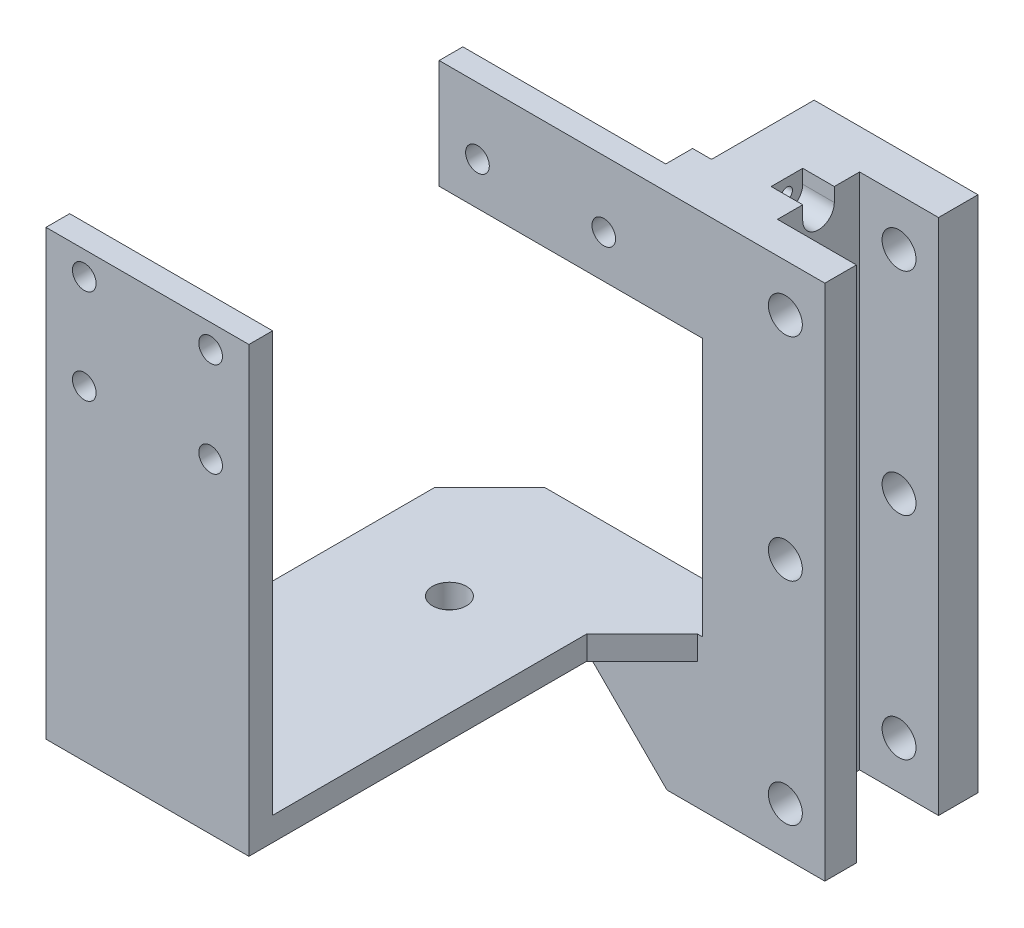
from build123d import *

# Parameters (mm, degrees)
SKETCH1_W                       = 14
SKETCH1_H                       = 4
BOSS_EXTRUDE1_DEPTH             = 10.2
SKETCH1_7_W                     = 14
SKETCH1_7_H                     = 4
BOSS_EXTRUDE2_DEPTH             = 3
BOSS_EXTRUDE3_START             = 10.2
SKETCH1_8_W                     = 14
SKETCH1_8_H                     = 4
BOSS_EXTRUDE3_DEPTH             = 3
BOSS_EXTRUDE6_START             = 13.2
SKETCH1_11_W                    = 14
SKETCH1_11_H                    = 4
BOSS_EXTRUDE6_DEPTH             = 3
BOSS_EXTRUDE4_START             = 14.1
SKETCH1_9_W                     = 14
SKETCH1_9_H                     = 4
SKETCH1_9_R                     = 2.15
SKETCH1_9_W_2                   = 19.7
SKETCH1_9_H_2                   = 40.2
BOSS_EXTRUDE4_DEPTH             = 3
BOSS_EXTRUDE7_START             = -18.65
SKETCH2_R                       = 2.15
BOSS_EXTRUDE7_DEPTH             = 3
SKETCH2_3_W                     = 14
SKETCH2_3_H                     = 4
BOSS_EXTRUDE9_DEPTH             = 21.65
BOSS_EXTRUDE8_REACH             = 52.867
SKETCH1_12_W                    = 25.7
SKETCH1_12_H                    = 3
BOSS_EXTRUDE8_DIRECTION_2_REACH = 52.867
BOSS_EXTRUDE10_OUTLINE_W        = 19.4
BOSS_EXTRUDE10_OUTLINE_H        = 65.6
BOSS_EXTRUDE10_DEPTH            = 26
CUT_EXTRUDE2_DEPTH              = 64.646916657
CUT_EXTRUDE2_DEPTH_BACK         = 64.646916657
SKETCH4_3_W                     = 5.6
SKETCH4_3_H                     = 13.8
CUT_EXTRUDE3_START              = -18.65
SKETCH6_R                       = 23.55
CUT_EXTRUDE3_DEPTH              = 32.75
BOSS_EXTRUDE11_START            = 26
SKETCH4_4_W                     = 5
SKETCH4_4_H                     = 12
SKETCH4_4_W_2                   = 4
SKETCH4_4_H_2                   = 14
SKETCH4_4_H_3                   = 6.75
SKETCH4_4_H_4                   = 7.05
SKETCH4_4_H_5                   = 13.8
SKETCH4_4_H_6                   = 1.8
BOSS_EXTRUDE11_DEPTH            = 10
CUT_EXTRUDE4_DEPTH              = 69.344202388
CUT_EXTRUDE4_DEPTH_BACK         = 69.344202388
SKETCH7_W                       = 15.846906961
SKETCH7_H                       = 18.461570713
SKETCH7_W_2                     = 11.728499311
SKETCH7_H_2                     = 5.461570713
CUT_EXTRUDE5_START              = 17.1
SKETCH1_14_R                    = 2.15
SKETCH1_14_W                    = 19.7
SKETCH1_14_H                    = 40.2
CUT_EXTRUDE5_DEPTH              = 10.8
CUT_EXTRUDE1_START              = 17.1
SKETCH3_W                       = 2
SKETCH3_H                       = 7
CUT_EXTRUDE1_DEPTH              = 1
CUT_EXTRUDE6_START              = 14.1
CUT_EXTRUDE6_OUTLINE_R          = 2.15
CUT_EXTRUDE6_DEPTH              = 3
CUT_EXTRUDE7_DEPTH              = 67.412442358
CUT_EXTRUDE7_DEPTH_BACK         = 67.412442358
SKETCH8_R                       = 2.15
CHAMFER1_SIZE                   = 7
CHAMFER2_SIZE                   = 7
CUT_EXTRUDE8_DEPTH              = 67.412442358
CUT_EXTRUDE8_DEPTH_BACK         = 67.412442358
SKETCH9_W                       = 15.2446712
SKETCH9_H                       = 13
CHAMFER4_SIZE                   = 16
SKETCH10_R                      = 0.7
CUT_EXTRUDE10_DEPTH             = 67.412442358
CUT_EXTRUDE11_START             = 22
SKETCH10_3_R                    = 0.7
CUT_EXTRUDE11_DEPTH             = 4
CUT_EXTRUDE12_START             = 17.1
CUT_EXTRUDE12_DEPTH             = 35.75
SKETCH14_W                      = 28.5
SKETCH14_H                      = 6.888877351
CUT_EXTRUDE13_DEPTH             = 67.412442358
BOSS_EXTRUDE13_START            = -18.65
SKETCH14_3_W                    = 25.7
SKETCH14_3_H                    = 3
BOSS_EXTRUDE13_DEPTH            = 53.15
BOSS_EXTRUDE14_START            = 12.85
SKETCH16_W                      = 3
SKETCH16_H                      = 13.8
BOSS_EXTRUDE14_DEPTH            = 25.7
CUT_EXTRUDE14_DEPTH             = 67.412442358
CUT_EXTRUDE14_DEPTH_BACK        = 67.412442358
SKETCH15_R                      = 1.5


# Read off the part's stored shape, not the designer's step: Boss-Extrude10, Cut-Extrude6
with BuildPart() as part:
    # Sketch1 → Boss-Extrude1 (new body)
    with BuildSketch(Plane(origin=(0, 0, 0), x_dir=(1, 0, 0), z_dir=(0, 1, 0))):
        with Locations((0, 42.2)):
            Rectangle(SKETCH1_W, SKETCH1_H)
    extrude(amount=BOSS_EXTRUDE1_DEPTH)

    # Sketch1<7> → Boss-Extrude2 (add)
    with BuildSketch(Plane(origin=(0, 0, 0), x_dir=(1, 0, 0), z_dir=(0, 1, 0))):
        with Locations((0, 42.2)):
            Rectangle(SKETCH1_7_W, SKETCH1_7_H)
    extrude(amount=-BOSS_EXTRUDE2_DEPTH)

    # Sketch1<8> → Boss-Extrude3 (add)
    with BuildSketch(Plane(origin=(0, 0, 0), x_dir=(1, 0, 0), z_dir=(0, 1, 0)).offset(BOSS_EXTRUDE3_START)):
        with Locations((0, 42.2)):
            Rectangle(SKETCH1_8_W, SKETCH1_8_H)
    extrude(amount=BOSS_EXTRUDE3_DEPTH)

    # Sketch1<11> → Boss-Extrude6 (add)
    with BuildSketch(Plane(origin=(0, 0, 0), x_dir=(1, 0, 0), z_dir=(0, 1, 0)).offset(BOSS_EXTRUDE6_START)):
        with Locations((0, 42.2)):
            Rectangle(SKETCH1_11_W, SKETCH1_11_H)
    extrude(amount=BOSS_EXTRUDE6_DEPTH)

    # Sketch1<9> → Boss-Extrude4 (add)
    # profile 1 of 3: a face of its own
    with BuildSketch(Plane(origin=(0, 0, 0), x_dir=(1, 0, 0), z_dir=(0, 1, 0)).offset(BOSS_EXTRUDE4_START)):
        with Locations((0, 42.2)):
            Rectangle(SKETCH1_9_W, SKETCH1_9_H)
    # profile 2 of 3: a face of its own
    with BuildSketch(Plane(origin=(0, 0, 0), x_dir=(1, 0, 0), z_dir=(0, 1, 0)).offset(BOSS_EXTRUDE4_START)):
        Polygon((12.85, -29.1), (12.85, 28.2), (7, 40.2), (-7, 40.2), (-12.85, 28.2), (-12.85, -29.1), align=None)
        with Locations(Location((5, -24.1, 0), (0, 0, 270))):
            Circle(SKETCH1_9_R, mode=Mode.SUBTRACT)
        with Locations(Location((-5, -24.1, 0), (0, 0, 270))):
            Circle(SKETCH1_9_R, mode=Mode.SUBTRACT)
        with Locations(Location((5, 24.1, 0), (0, 0, 270))):
            Circle(SKETCH1_9_R, mode=Mode.SUBTRACT)
        with Locations(Location((-5, 24.1, 0), (0, 0, 270))):
            Circle(SKETCH1_9_R, mode=Mode.SUBTRACT)
        Rectangle(SKETCH1_9_W_2, SKETCH1_9_H_2, mode=Mode.SUBTRACT)
    # profile 3 of 3: a face of its own
    with BuildSketch(Plane(origin=(0, 0, 0), x_dir=(1, 0, 0), z_dir=(0, 1, 0)).offset(BOSS_EXTRUDE4_START)):
        Polygon((7, 40.2), (-7, 40.2), (-12.41125, 29.1), (12.41125, 29.1), align=None)
    extrude(amount=BOSS_EXTRUDE4_DEPTH)



with BuildPart() as body_2:
    # Sketch2 → Boss-Extrude7 (new body)
    with BuildSketch(Plane(origin=(0, 0, 0), x_dir=(1, 0, 0), z_dir=(0, 1, 0)).offset(BOSS_EXTRUDE7_START)):
        Polygon((7, 44.2), (-7, 44.2), (-7, 40.2), (-12.85, 28.2), (-12.85, -29.1), (12.85, -29.1), (12.85, 28.2), (7, 40.2), align=None)
        with Locations(Location((0, 10.2, 0), (0, 0, 270))):
            Circle(SKETCH2_R, mode=Mode.SUBTRACT)
    extrude(amount=-BOSS_EXTRUDE7_DEPTH)


with BuildPart() as part_1:
    add(part.part)

    add(body_2.part)  # Boss-Extrude9 merges body 2
    # Sketch2<3> → Boss-Extrude9 (add)
    with BuildSketch(Plane(origin=(0, 0, 0), x_dir=(1, 0, 0), z_dir=(0, 1, 0))):
        with Locations((0, 42.2)):
            Rectangle(SKETCH2_3_W, SKETCH2_3_H)
    extrude(amount=-BOSS_EXTRUDE9_DEPTH)

    # Boss-Extrude8: up to this face of the body (flat: up to its plane)
    boss_extrude8_end = Plane(part_1.part.faces().sort_by_distance((6.22325165, 17.1, -42.2))[0])
    # Sketch1<12> → Boss-Extrude8 (add, up to the picked face)
    with BuildSketch(Plane(origin=(0, 0, 0), x_dir=(1, 0, 0), z_dir=(0, 1, 0)), mode=Mode.PRIVATE) as boss_extrude8_sk1:
        with Locations((0, -30.6)):
            Rectangle(SKETCH1_12_W, SKETCH1_12_H)
    boss_extrude8_tool1 = split(extrude(boss_extrude8_sk1.sketch, amount=BOSS_EXTRUDE8_REACH, mode=Mode.PRIVATE), bisect_by=boss_extrude8_end, keep=Keep.BOTH, mode=Mode.PRIVATE)
    add(boss_extrude8_tool1.solids().sort_by(Axis((0, 0, 30.6), (0, 1, 0)))[0])

    # Boss-Extrude8 direction 2: up to this face of the body (flat: up to its plane)
    boss_extrude8_direction_2_end = Plane(part_1.part.faces().sort_by_distance((0, -21.65, -5.454834504))[0])
    # Sketch1<12> → Boss-Extrude8 direction 2 (add, up to the picked face)
    with BuildSketch(Plane(origin=(0, 0, 0), x_dir=(1, 0, 0), z_dir=(0, 1, 0)), mode=Mode.PRIVATE) as boss_extrude8_direction_2_sk1:
        with Locations((0, -30.6)):
            Rectangle(SKETCH1_12_W, SKETCH1_12_H)
    boss_extrude8_direction_2_tool1 = split(extrude(boss_extrude8_direction_2_sk1.sketch, amount=-BOSS_EXTRUDE8_DIRECTION_2_REACH, mode=Mode.PRIVATE), bisect_by=boss_extrude8_direction_2_end, keep=Keep.BOTH, mode=Mode.PRIVATE)
    add(boss_extrude8_direction_2_tool1.solids().sort_by(Axis((0, 0, 30.6), (0, -1, 0)))[0])

    # Boss-Extrude10 outline → Boss-Extrude10 (add)
    with BuildSketch(Plane(origin=(0, 0, 0), x_dir=(0, 0, -1), z_dir=(1, 0, 0))):
        with Locations((31.45, -4.9)):
            Rectangle(BOSS_EXTRUDE10_OUTLINE_W, BOSS_EXTRUDE10_OUTLINE_H)
    extrude(amount=BOSS_EXTRUDE10_DEPTH)

    # Sketch4<3> → Cut-Extrude2 (cut, two sides: drawn at the far end of the back side and taken through both)
    with BuildSketch(Plane(origin=(0, 0, 0), x_dir=(0, 0, -1), z_dir=(1, 0, 0)).offset(-CUT_EXTRUDE2_DEPTH_BACK)):
        with Locations((30.95, -18.8)):
            Rectangle(SKETCH4_3_W, SKETCH4_3_H)
        with Locations((30.95, 9)):
            Rectangle(SKETCH4_3_W, SKETCH4_3_H)
    extrude(amount=CUT_EXTRUDE2_DEPTH + CUT_EXTRUDE2_DEPTH_BACK, mode=Mode.SUBTRACT)

    # Sketch6 → Cut-Extrude3 (cut)
    with BuildSketch(Plane(origin=(0, 0, 0), x_dir=(1, 0, 0), z_dir=(0, 1, 0)).offset(CUT_EXTRUDE3_START)):
        with Locations((0, 10.2)):
            Circle(SKETCH6_R)
    extrude(amount=CUT_EXTRUDE3_DEPTH, mode=Mode.SUBTRACT)

    # Sketch4<4> → Boss-Extrude11 (add)
    with BuildSketch(Plane(origin=(0, 0, 0), x_dir=(0, 0, -1), z_dir=(1, 0, 0)).offset(BOSS_EXTRUDE11_START)):
        with Locations((38.65, 21.9)):
            Rectangle(SKETCH4_4_W, SKETCH4_4_H)
        with Locations((23.75, 21.9)):
            Rectangle(SKETCH4_4_W_2, SKETCH4_4_H)
        with Locations((23.75, -31.7)):
            Rectangle(SKETCH4_4_W_2, SKETCH4_4_H)
        with Locations((38.65, -31.7)):
            Rectangle(SKETCH4_4_W, SKETCH4_4_H)
        with Locations((38.65, -4.9)):
            Rectangle(SKETCH4_4_W, SKETCH4_4_H_2)
        with Locations((23.75, -4.9)):
            Rectangle(SKETCH4_4_W_2, SKETCH4_4_H_2)
        with Locations((23.75, 8.1)):
            Rectangle(SKETCH4_4_W_2, SKETCH4_4_H)
        with Locations((23.75, -15.275)):
            Rectangle(SKETCH4_4_W_2, SKETCH4_4_H_3)
        with Locations((23.75, -22.175)):
            Rectangle(SKETCH4_4_W_2, SKETCH4_4_H_4)
        with Locations((38.65, -18.8)):
            Rectangle(SKETCH4_4_W, SKETCH4_4_H_5)
        with Locations((38.65, 9)):
            Rectangle(SKETCH4_4_W, SKETCH4_4_H_5)
        with Locations((23.75, 15)):
            Rectangle(SKETCH4_4_W_2, SKETCH4_4_H_6)
    extrude(amount=BOSS_EXTRUDE11_DEPTH)

    # Sketch7 → Cut-Extrude4 (cut, two sides: drawn at the far end of the back side and taken through both)
    with BuildSketch(Plane(origin=(0, 0, 0), x_dir=(1, 0, 0), z_dir=(0, 1, 0)).offset(-CUT_EXTRUDE4_DEPTH_BACK)):
        with Locations((-7.923453481, 37.380785357)):
            Rectangle(SKETCH7_W, SKETCH7_H)
        with Locations((5.864249656, 43.880785357)):
            Rectangle(SKETCH7_W_2, SKETCH7_H_2)
    extrude(amount=CUT_EXTRUDE4_DEPTH + CUT_EXTRUDE4_DEPTH_BACK, mode=Mode.SUBTRACT)

    # Sketch1<14> → Cut-Extrude5 (cut)
    # profile 1 of 5: a face of its own
    with BuildSketch(Plane(origin=(0, 0, 0), x_dir=(1, 0, 0), z_dir=(0, 1, 0)).offset(CUT_EXTRUDE5_START)):
        Polygon((12.41125, 29.1), (-12.41125, 29.1), (-12.85, 28.2), (-12.85, -29.1), (12.85, -29.1), (12.85, 28.2), align=None)
        with Locations(Location((-5, -24.1, 0), (0, 0, 270))):
            Circle(SKETCH1_14_R, mode=Mode.SUBTRACT)
        with Locations(Location((5, -24.1, 0), (0, 0, 270))):
            Circle(SKETCH1_14_R, mode=Mode.SUBTRACT)
        Rectangle(SKETCH1_14_W, SKETCH1_14_H, mode=Mode.SUBTRACT)
        with Locations(Location((-5, 24.1, 0), (0, 0, 270))):
            Circle(SKETCH1_14_R, mode=Mode.SUBTRACT)
        with Locations((5, 24.1)):
            Circle(SKETCH1_14_R, mode=Mode.SUBTRACT)
    # profile 2 of 5: a face of its own
    with BuildSketch(Plane(origin=(0, 0, 0), x_dir=(1, 0, 0), z_dir=(0, 1, 0)).offset(CUT_EXTRUDE5_START)):
        with Locations((5, 24.1)):
            Circle(SKETCH1_14_R)
    # profile 3 of 5: a face of its own
    with BuildSketch(Plane(origin=(0, 0, 0), x_dir=(1, 0, 0), z_dir=(0, 1, 0)).offset(CUT_EXTRUDE5_START)):
        with Locations(Location((-5, 24.1, 0), (0, 0, 270))):
            Circle(SKETCH1_14_R)
    # profile 4 of 5: a face of its own
    with BuildSketch(Plane(origin=(0, 0, 0), x_dir=(1, 0, 0), z_dir=(0, 1, 0)).offset(CUT_EXTRUDE5_START)):
        with Locations(Location((-5, -24.1, 0), (0, 0, 270))):
            Circle(SKETCH1_14_R)
    # profile 5 of 5: a face of its own
    with BuildSketch(Plane(origin=(0, 0, 0), x_dir=(1, 0, 0), z_dir=(0, 1, 0)).offset(CUT_EXTRUDE5_START)):
        with Locations(Location((5, -24.1, 0), (0, 0, 270))):
            Circle(SKETCH1_14_R)
    extrude(amount=CUT_EXTRUDE5_DEPTH, mode=Mode.SUBTRACT)

    # Sketch3 → Cut-Extrude1 (cut)
    with BuildSketch(Plane(origin=(0, 0, 0), x_dir=(1, 0, 0), z_dir=(0, 1, 0)).offset(CUT_EXTRUDE1_START)):
        with Locations((0, -23.6)):
            Rectangle(SKETCH3_W, SKETCH3_H)
    cut_extrude1 = extrude(amount=-CUT_EXTRUDE1_DEPTH, mode=Mode.SUBTRACT)

    # Mirror2: Cut-Extrude1 across plane
    add(cut_extrude1.mirror(Plane.XY), mode=Mode.SUBTRACT)

    # Cut-Extrude6 outline → Cut-Extrude6 (cut)
    with BuildSketch(Plane(origin=(0, 0, 0), x_dir=(1, 0, 0), z_dir=(0, 1, 0)).offset(CUT_EXTRUDE6_START)):
        with Locations((5, 24.1)):
            Circle(CUT_EXTRUDE6_OUTLINE_R)
    extrude(amount=CUT_EXTRUDE6_DEPTH, mode=Mode.SUBTRACT)

    # Sketch8 → Cut-Extrude7 (cut, two sides: drawn at the far end of the back side and taken through both)
    with BuildSketch(Plane.XY.offset(-CUT_EXTRUDE7_DEPTH_BACK)):
        with Locations(Location((31, 21.9, 0), (0, 0, 90))):
            Circle(SKETCH8_R)
        with Locations(Location((31, -4.9, 0), (0, 0, 90))):
            Circle(SKETCH8_R)
        with Locations(Location((31, -31.7, 0), (0, 0, 90))):
            Circle(SKETCH8_R)
    extrude(amount=CUT_EXTRUDE7_DEPTH + CUT_EXTRUDE7_DEPTH_BACK, mode=Mode.SUBTRACT)

    # Chamfer1
    chamfer1_edges = [part_1.edges().sort_by_distance(p)[0] for p in [
        (12.85, 15.6, -21.75),
        (12.85, -20.15, -21.75),
    ]]
    chamfer(chamfer1_edges, length=CHAMFER1_SIZE)

    # Chamfer2
    chamfer2_edges = [part_1.edges().sort_by_distance(p)[0] for p in [
        (0, -4.9, -41.15),
        (-12.85, -20.15, -28.15),
        (-12.85, 15.6, -28.15),
    ]]
    chamfer(chamfer2_edges, length=CHAMFER2_SIZE)

    # Sketch9 → Cut-Extrude8 (cut, two sides: drawn at the far end of the back side and taken through both)
    with BuildSketch(Plane(origin=(0, 0, 0), x_dir=(1, 0, 0), z_dir=(0, 1, 0)).offset(-CUT_EXTRUDE8_DEPTH_BACK)):
        with Locations((7.6223356, 34.65)):
            Rectangle(SKETCH9_W, SKETCH9_H)
    extrude(amount=CUT_EXTRUDE8_DEPTH + CUT_EXTRUDE8_DEPTH_BACK, mode=Mode.SUBTRACT)

    # Chamfer4
    chamfer4_edges = [part_1.edges().sort_by_distance(p)[0] for p in [
        (0, -37.7, -24.95),
    ]]
    chamfer(chamfer4_edges, length=CHAMFER4_SIZE)

    # Sketch10 → Cut-Extrude10 (cut, through all)
    with BuildSketch(Plane(origin=(0, 0, 0), x_dir=(0, 0, -1), z_dir=(1, 0, 0))):
        with Locations((30.95, 26.15)):
            Circle(SKETCH10_R)
        with Locations((30.95, -35.95)):
            Circle(SKETCH10_R)
    extrude(amount=CUT_EXTRUDE10_DEPTH, mode=Mode.SUBTRACT)

    # Sketch10<3> → Cut-Extrude11 (cut)
    # profile 1 of 2: a face of its own
    with BuildSketch(Plane(origin=(0, 0, 0), x_dir=(0, 0, -1), z_dir=(1, 0, 0)).offset(CUT_EXTRUDE11_START)):
        with BuildLine():
            Line((32.95, 27.9), (28.95, 27.9))
            Line((28.95, 27.9), (28.95, 26.15))
            ThreePointArc((28.95, 26.15), (30.95, 24.15), (32.95, 26.15))
            Line((32.95, 26.15), (32.95, 27.9))
        make_face()
        with Locations((30.95, 26.15)):
            Circle(SKETCH10_3_R, mode=Mode.SUBTRACT)
    # profile 2 of 2: a face of its own
    with BuildSketch(Plane(origin=(0, 0, 0), x_dir=(0, 0, -1), z_dir=(1, 0, 0)).offset(CUT_EXTRUDE11_START)):
        with BuildLine():
            Line((28.95, -37.7), (32.95, -37.7))
            Line((32.95, -37.7), (32.95, -35.95))
            ThreePointArc((32.95, -35.95), (30.95, -33.95), (28.95, -35.95))
            Line((28.95, -35.95), (28.95, -37.7))
        make_face()
        with Locations((30.95, -35.95)):
            Circle(SKETCH10_3_R, mode=Mode.SUBTRACT)
    extrude(amount=CUT_EXTRUDE11_DEPTH, mode=Mode.SUBTRACT)

    # Sketch12 → Cut-Extrude12 (cut)
    with BuildSketch(Plane(origin=(0, 0, 0), x_dir=(1, 0, 0), z_dir=(0, 1, 0)).offset(CUT_EXTRUDE12_START)):
        Polygon((12.85, 14.75), (19.85, 21.75), (12.85, 21.75), (12.85, 28.15), (-5.85, 28.15), (-12.85, 21.15), (-12.85, -32.1), (12.85, -32.1), align=None)
    extrude(amount=-CUT_EXTRUDE12_DEPTH, mode=Mode.SUBTRACT)

    # Sketch14 → Cut-Extrude13 (cut, through all)
    with BuildSketch(Plane(origin=(0, 0, 0), x_dir=(1, 0, 0), z_dir=(0, 1, 0))):
        with Locations((0, -31.494438675)):
            Rectangle(SKETCH14_W, SKETCH14_H)
    extrude(amount=-CUT_EXTRUDE13_DEPTH, mode=Mode.SUBTRACT)

    # Sketch14<3> → Boss-Extrude13 (add)
    with BuildSketch(Plane(origin=(0, 0, 0), x_dir=(1, 0, 0), z_dir=(0, 1, 0)).offset(BOSS_EXTRUDE13_START)):
        with Locations((0, -26.55)):
            Rectangle(SKETCH14_3_W, SKETCH14_3_H)
    extrude(amount=BOSS_EXTRUDE13_DEPTH)

    # Sketch16 → Boss-Extrude14 (add)
    with BuildSketch(Plane(origin=(0, 0, 0), x_dir=(0, 0, -1), z_dir=(1, 0, 0)).offset(BOSS_EXTRUDE14_START)):
        with Locations((23.25, 21)):
            Rectangle(SKETCH16_W, SKETCH16_H)
    extrude(amount=-BOSS_EXTRUDE14_DEPTH)

    # Sketch15 → Cut-Extrude14 (cut, two sides: drawn at the far end of the back side and taken through both)
    with BuildSketch(Plane.XY.offset(-CUT_EXTRUDE14_DEPTH_BACK)):
        with Locations(Location((-8, 31.5, 0), (0, 0, 180))):
            Circle(SKETCH15_R)
        with Locations(Location((8, 31.5, 0), (0, 0, 180))):
            Circle(SKETCH15_R)
        with Locations(Location((8, 19.5, 0), (0, 0, 180))):
            Circle(SKETCH15_R)
        with Locations(Location((-8, 19.5, 0), (0, 0, 180))):
            Circle(SKETCH15_R)
    extrude(amount=CUT_EXTRUDE14_DEPTH + CUT_EXTRUDE14_DEPTH_BACK, mode=Mode.SUBTRACT)


solid = part_1.part
